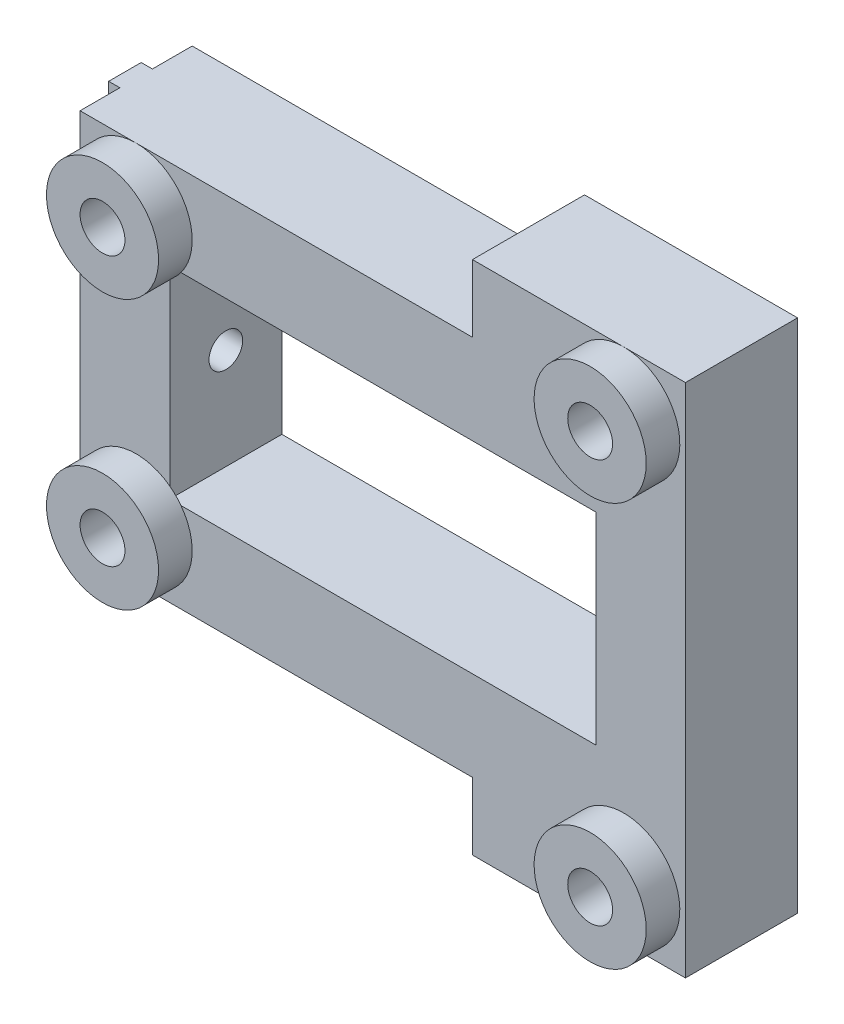
from build123d import *

# Parameters (mm, degrees)
ESQUISSE1_W             = 54
ESQUISSE1_H             = 46
BOSS_EXTRU_1_DEPTH      = 10
ESQUISSE2_R             = 2
ENL_V_MAT_EXTRU_1_DEPTH = 37.851051545
ESQUISSE3_R             = 5
BOSS_EXTRU_2_DEPTH      = 3
ESQUISSE4_W             = 35
ESQUISSE4_H             = 10
ENL_V_MAT_EXTRU_2_DEPTH = 6
ESQUISSE6_W             = 35
ESQUISSE6_H             = 10
ENL_V_MAT_EXTRU_3_DEPTH = 6
ESQUISSE7_W             = 2.9
ESQUISSE7_H             = 34
BOSS_EXTRU_3_DEPTH      = 1
ESQUISSE10_W            = 38
ESQUISSE10_H            = 18
ENL_V_MAT_EXTRU_5_DEPTH = 38.589892258
ENL_V_MAT_EXTRU_4_REACH = 63.016
ESQUISSE8_R             = 1.5
ESQUISSE11_R            = 2
ENL_V_MAT_EXTRU_6_DEPTH = 38.589892258


with BuildPart() as part:
    # Esquisse1 → Boss.-Extru.1 (new body)
    with BuildSketch(Plane.XY):
        Rectangle(ESQUISSE1_W, ESQUISSE1_H)
    extrude(amount=BOSS_EXTRU_1_DEPTH)

    # Esquisse2 → Enlèv. mat.-Extru.1 (cut, through all)
    with BuildSketch(Plane.XY.offset(10)):
        with Locations((-22, -12)):
            Circle(ESQUISSE2_R)
        with Locations((-22, 12)):
            Circle(ESQUISSE2_R)
        with Locations((21.5, 18)):
            Circle(ESQUISSE2_R)
        with Locations((21.5, -18)):
            Circle(ESQUISSE2_R)
    extrude(amount=-ENL_V_MAT_EXTRU_1_DEPTH, mode=Mode.SUBTRACT)

    # Esquisse3 → Boss.-Extru.2 (add)
    with BuildSketch(Plane.XY.offset(10)):
        with Locations((-22, 12)):
            Circle(ESQUISSE3_R)
        with Locations((-22, -12)):
            Circle(ESQUISSE3_R)
        with Locations((21.5, -18)):
            Circle(ESQUISSE3_R)
        with Locations((21.5, 18)):
            Circle(ESQUISSE3_R)
    extrude(amount=BOSS_EXTRU_2_DEPTH)

    # Esquisse4 → Enlèv. mat.-Extru.2 (cut)
    with BuildSketch(Plane.XZ.offset(23)):
        with Locations((-9.5, 5)):
            Rectangle(ESQUISSE4_W, ESQUISSE4_H)
    extrude(amount=-ENL_V_MAT_EXTRU_2_DEPTH, mode=Mode.SUBTRACT)

    # Esquisse6 → Enlèv. mat.-Extru.3 (cut)
    with BuildSketch(Plane(origin=(0, 23, 0), x_dir=(1, 0, 0), z_dir=(0, 1, 0))):
        with Locations((-9.5, -5)):
            Rectangle(ESQUISSE6_W, ESQUISSE6_H)
    extrude(amount=-ENL_V_MAT_EXTRU_3_DEPTH, mode=Mode.SUBTRACT)

    # Esquisse7 → Boss.-Extru.3 (add)
    with BuildSketch(Plane.ZY.offset(27)):
        with Locations((5, 0)):
            Rectangle(ESQUISSE7_W, ESQUISSE7_H)
    extrude(amount=BOSS_EXTRU_3_DEPTH)

    # Esquisse10 → Enlèv. mat.-Extru.5 (cut, through all)
    with BuildSketch(Plane.XY.offset(10)):
        Rectangle(ESQUISSE10_W, ESQUISSE10_H)
    extrude(amount=-ENL_V_MAT_EXTRU_5_DEPTH, mode=Mode.SUBTRACT)

    # Esquisse8 → Enlèv. mat.-Extru.4 (cut, up to next)
    with BuildSketch(Plane.ZY.offset(28), mode=Mode.PRIVATE) as enl_v_mat_extru_4_sk1:
        with Locations((5, 0)):
            Circle(ESQUISSE8_R)
    enl_v_mat_extru_4_tool1 = extrude(enl_v_mat_extru_4_sk1.sketch, amount=-ENL_V_MAT_EXTRU_4_REACH, mode=Mode.PRIVATE) & part.part
    add(enl_v_mat_extru_4_tool1.solids().sort_by_distance((-28, 0, 5))[0], mode=Mode.SUBTRACT)

    # Esquisse11 → Enlèv. mat.-Extru.6 (cut, through all)
    with BuildSketch(Plane(origin=(0, 0, 10), x_dir=(-1, 0, 0), z_dir=(0, 0, -1))):
        with Locations((-21.5, 18)):
            Circle(ESQUISSE11_R)
        with Locations((22, 12)):
            Circle(ESQUISSE11_R)
        with Locations((22, -12)):
            Circle(ESQUISSE11_R)
        with Locations((-21.5, -18)):
            Circle(ESQUISSE11_R)
    extrude(amount=-ENL_V_MAT_EXTRU_6_DEPTH, mode=Mode.SUBTRACT)


solid = part.part
